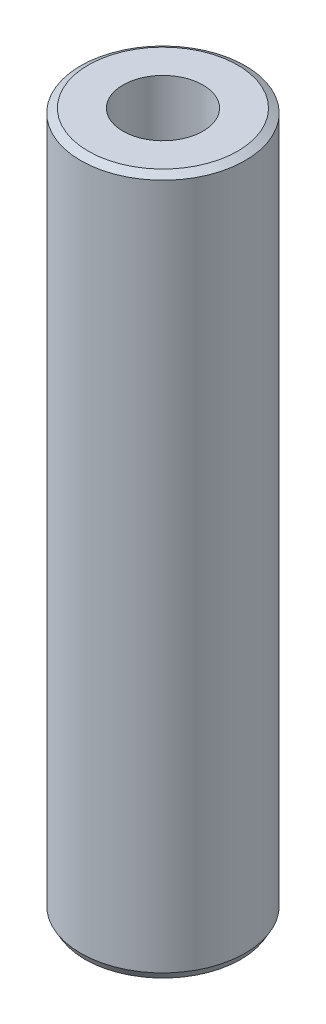
from build123d import *
from OCP.BRepFilletAPI import BRepFilletAPI_MakeChamfer

# Parameters (mm, degrees)
SKETCH1_R           = 10
BOSS_EXTRUDE1_DEPTH = 84.929521336
SKETCH2_R           = 4.869798111
CUT_EXTRUDE1_DEPTH  = 87.098917498
CHAMFER1_SIZE       = 0.530528897
CHAMFER1_SIZE2      = 0.918903005


with BuildPart() as part:
    # Sketch1 → Boss-Extrude1 (new body)
    with BuildSketch(Plane(origin=(0, 0, 0), x_dir=(1, 0, 0), z_dir=(0, 1, 0))):
        Circle(SKETCH1_R)
    extrude(amount=BOSS_EXTRUDE1_DEPTH)

    # Sketch2 → Cut-Extrude1 (cut, through all)
    with BuildSketch(Plane(origin=(0, 0, 0), x_dir=(1, 0, 0), z_dir=(0, 1, 0))):
        Circle(SKETCH2_R)
    extrude(amount=CUT_EXTRUDE1_DEPTH, mode=Mode.SUBTRACT)

    # Chamfer1: one chamfer whose edges measure the first distance from different faces: ONE call of the kernel's chamfer builder (chamfer() names one face for all edges)
    chamfer1_edges_1 = [part.edges().sort_by_distance(p)[0] for p in [
        (-10, 84.929521336, 0),
    ]]
    chamfer1_side_1 = [part.faces().sort_by_distance(p)[0] for p in [
        (-10, 42.464760668, 0),
    ]]
    chamfer1_edges_2 = [part.edges().sort_by_distance(p)[0] for p in [
        (-10, 0, 0),
    ]]
    chamfer1_side_2 = [part.faces().sort_by_distance(p)[0] for p in [
        (-9.717157288, 0, 0),
    ]]
    chamfer1 = BRepFilletAPI_MakeChamfer(part.part.solid().wrapped)
    for e in chamfer1_edges_1:
        chamfer1.Add(CHAMFER1_SIZE, CHAMFER1_SIZE2, e.wrapped, chamfer1_side_1[0].wrapped)  # the first distance lies on this face
    for e in chamfer1_edges_2:
        chamfer1.Add(CHAMFER1_SIZE, CHAMFER1_SIZE2, e.wrapped, chamfer1_side_2[0].wrapped)  # the first distance lies on this face
    add(Compound.cast(chamfer1.Shape()), mode=Mode.REPLACE)


solid = part.part
